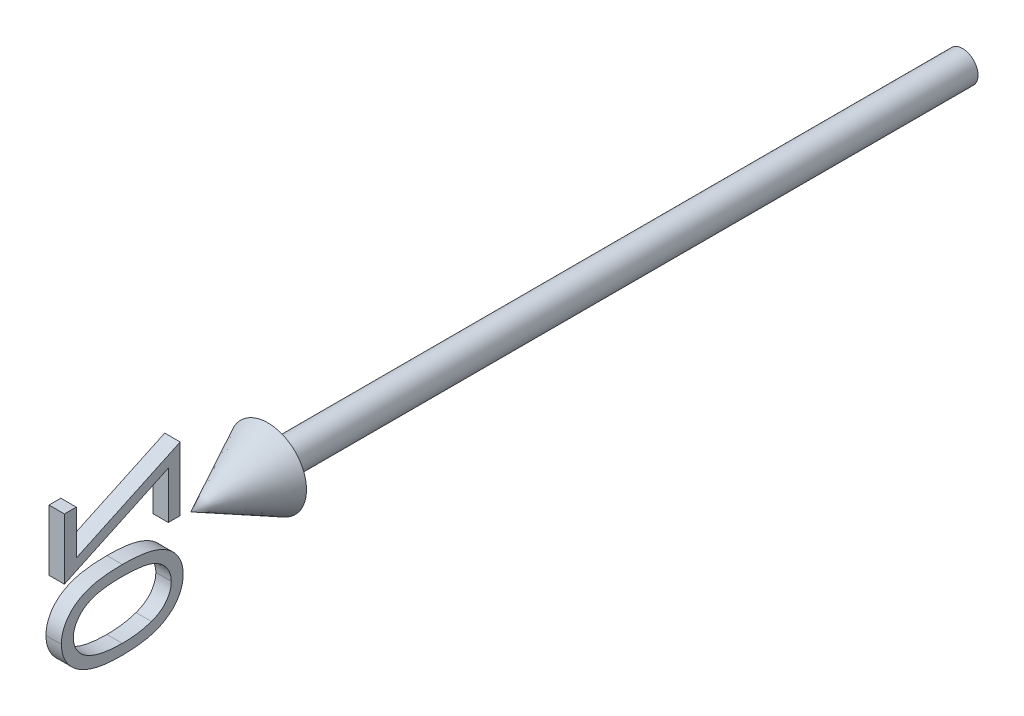
from build123d import *

# Parameters (mm, degrees)
BOSS_EXTRUDE1_DEPTH        = 1
BOSS_EXTRUDE1_DEPTH_BACK   = 1
BOSS_EXTRUDE1_2_DEPTH      = 1
BOSS_EXTRUDE1_2_DEPTH_BACK = 1


with BuildPart() as part:
    # Sketch2 → Revolve1 (revolve)
    with BuildSketch(Plane(origin=(0, 0, 0), x_dir=(1, 0, 0), z_dir=(0, 1, 0))):
        Polygon((0, -100), (5, -90), (2, -90), (2, 0), (0, 0), align=None)
    revolve(axis=Axis((0, 0, -41.949952025), (0, 0, 1)))


with BuildPart() as body_2:
    # Sketch3 → Boss-Extrude1 (new, two sides: drawn at the far end of the back side and taken through both)
    with BuildSketch(Plane(origin=(0, 0, 0), x_dir=(0, -1, 0), z_dir=(1, 0, 0)).offset(-BOSS_EXTRUDE1_DEPTH_BACK)):
        Polygon((-8.958586521, -115.829050545), (-8.958586521, -117.367512083), (-1.073971137, -117.367512083), (-7.366038444, -103.905973622), (-1.266278829, -103.905973622), (-1.266278829, -102.367512083), (-9.535509598, -102.367512083), (-3.243442291, -115.829050545), align=None)
    extrude(amount=BOSS_EXTRUDE1_DEPTH + BOSS_EXTRUDE1_DEPTH_BACK)


with BuildPart() as body_3:
    # Sketch3 → Boss-Extrude1 2 (new, two sides: drawn at the far end of the back side and taken through both)
    with BuildSketch(Plane(origin=(0, 0, 0), x_dir=(0, -1, 0), z_dir=(1, 0, 0)).offset(-BOSS_EXTRUDE1_2_DEPTH_BACK)):
        with BuildLine():
            add(Edge.make_bspline(
                [(0.464490402, -109.861502468), (0.465896194, -110.101919844), (0.468626965, -110.568934062), (0.499005913, -111.24943967), (0.549471662, -111.887840912), (0.618631845, -112.484168325), (0.702794571, -113.038575931), (0.815146812, -113.549581885), (0.942915443, -114.019552124), (1.090999113, -114.450016379), (1.258083581, -114.846783703), (1.439966057, -115.217157182), (1.643739441, -115.560694379), (1.858196956, -115.882456895), (2.090844214, -116.179206612), (2.340872181, -116.449609881), (2.606078592, -116.697857002), (2.88771833, -116.919865871), (3.183107018, -117.113316985), (3.483506669, -117.288676045), (3.7974853, -117.427389898), (4.117298457, -117.54600622), (4.445522801, -117.639966378), (4.782301317, -117.705323043), (5.127936212, -117.746211561), (5.361209824, -117.75013679), (5.47951444, -117.752127468)],
                knots=[0, 0, 0, 0, 1.64625301, 3.197870201, 4.6634513, 6.030635694, 7.308242971, 8.501545196, 9.611429483, 10.641742253, 11.616230371, 12.55791849, 13.464870342, 14.34944951, 15.20427819, 16.044004467, 16.869007726, 17.689551165, 18.496129964, 19.285613293, 20.0683943, 20.843080271, 21.620342827, 22.403213977, 23.190190624, 24, 24, 24, 24], degree=3))
            add(Edge.make_bspline(
                [(5.47951444, -117.752127468), (5.598867202, -117.750472111), (5.836337191, -117.747178534), (6.186159255, -117.700819453), (6.529888015, -117.640982447), (6.862308428, -117.545013741), (7.189705924, -117.430174739), (7.503938784, -117.278646501), (7.81610109, -117.113847775), (8.112011727, -116.912807191), (8.400511963, -116.690624262), (8.670950813, -116.438389837), (8.930241416, -116.16308453), (9.168590469, -115.858568228), (9.396213279, -115.529510069), (9.604469055, -115.173151597), (9.797689138, -114.790282552), (9.979505552, -114.38267786), (10.138499204, -113.939449766), (10.279857271, -113.463362801), (10.395724126, -112.950105768), (10.491543977, -112.402537834), (10.565918422, -111.817946355), (10.620046885, -111.197515781), (10.648649073, -110.540857962), (10.654034477, -110.091895611), (10.656798094, -109.861502468)],
                knots=[0, 0, 0, 0, 0.810910589, 1.61342667, 2.396193133, 3.181089899, 3.963115317, 4.752255436, 5.550715454, 6.36105385, 7.181178335, 8.024612154, 8.872680183, 9.750181803, 10.651284446, 11.591556747, 12.554036451, 13.566402641, 14.62422919, 15.753422176, 16.94128843, 18.199818041, 19.531985927, 20.947085226, 22.433341622, 24, 24, 24, 24], degree=3))
            add(Edge.make_bspline(
                [(10.656798094, -109.861502468), (10.653970235, -109.632117153), (10.648447932, -109.184168749), (10.620697831, -108.530422948), (10.564467416, -107.913377908), (10.495932708, -107.332139642), (10.397119068, -106.787467926), (10.287109959, -106.276437669), (10.146787166, -105.803850614), (9.991564806, -105.364421768), (9.812278245, -104.958543726), (9.620513341, -104.57725504), (9.409148778, -104.222918982), (9.185893633, -103.891775084), (8.943032158, -103.58987039), (8.687250529, -103.311485461), (8.414188003, -103.05881281), (8.124202643, -102.8340065), (7.825495117, -102.631451496), (7.513271955, -102.460776547), (7.19484201, -102.311982821), (6.866893202, -102.192370066), (6.531516762, -102.097815713), (6.187504946, -102.033448325), (5.836290408, -101.988077422), (5.598851553, -101.984629586), (5.47951444, -101.982896699)],
                knots=[0, 0, 0, 0, 1.561431216, 3.049195289, 4.452146966, 5.778046447, 7.031138842, 8.218704273, 9.334037798, 10.384210803, 11.388620812, 12.352076869, 13.287433199, 14.19507451, 15.06813243, 15.922055533, 16.766344942, 17.596869952, 18.417486629, 19.220035357, 20.016159057, 20.807716045, 21.59340902, 22.384936649, 23.188266813, 24, 24, 24, 24], degree=3))
            add(Edge.make_bspline(
                [(5.47951444, -101.982896699), (5.361213947, -101.984905019), (5.127948465, -101.988865035), (4.782254012, -102.029498724), (4.44596381, -102.095758583), (4.118405567, -102.18573913), (3.79890901, -102.300099116), (3.490603617, -102.445560608), (3.189418903, -102.614273953), (2.896724751, -102.806214516), (2.618116601, -103.026182731), (2.351933625, -103.269425772), (2.105142979, -103.542212281), (1.874100145, -103.84018837), (1.657863216, -104.162760869), (1.454952755, -104.508928029), (1.273624174, -104.88290958), (1.102751263, -105.281830782), (0.952125487, -105.715457976), (0.82060184, -106.187038734), (0.709715439, -106.699789674), (0.621392873, -107.253735339), (0.549036995, -107.848018185), (0.499055664, -108.483585234), (0.468642154, -109.159075157), (0.465899573, -109.623087332), (0.464490402, -109.861502468)],
                knots=[0, 0, 0, 0, 0.810976328, 1.599087026, 2.383086309, 3.159618043, 3.926613167, 4.707144544, 5.494386734, 6.292609454, 7.104690378, 7.92621526, 8.762510248, 9.62398222, 10.509836085, 11.424023232, 12.373226806, 13.358118208, 14.398657954, 15.5185989, 16.713620699, 17.994156382, 19.364120462, 20.818119981, 22.365111093, 24, 24, 24, 24], degree=3))
        make_face()
        with BuildLine():
            add(Edge.make_bspline(
                [(1.810644248, -109.867512083), (1.811167389, -109.667161318), (1.812182703, -109.278319823), (1.83793945, -108.714264865), (1.873790211, -108.187286863), (1.918892548, -107.697591511), (1.986439653, -107.246890218), (2.063076152, -106.833309457), (2.154996357, -106.457614093), (2.264292702, -106.116523199), (2.388785301, -105.805199362), (2.524493273, -105.515370407), (2.671494339, -105.243510994), (2.833161137, -104.990601992), (3.011809892, -104.758055959), (3.203453101, -104.544768457), (3.40920511, -104.351607934), (3.69396548, -104.122365531), (4.068073456, -103.882684347), (4.541843799, -103.67653575), (5.028878765, -103.546147131), (5.35954219, -103.529611622), (5.524586556, -103.521358237)],
                knots=[0, 0, 0, 0, 1.459193451, 2.832007961, 4.111736495, 5.306635028, 6.412683014, 7.430020708, 8.369596877, 9.227877302, 10.036669781, 10.810175692, 11.557788084, 12.286326232, 12.994037279, 13.69140682, 14.37267704, 15.047194847, 16.352618509, 17.594157723, 18.799169539, 20, 20, 20, 20], degree=3))
            add(Edge.make_bspline(
                [(5.524586556, -103.521358237), (5.690578634, -103.528595325), (6.021973981, -103.54304383), (6.508677441, -103.669144688), (6.977262383, -103.874144638), (7.347064651, -104.108352222), (7.627622934, -104.332823763), (7.828712483, -104.523986677), (8.013259468, -104.738095126), (8.188298224, -104.969088809), (8.34883676, -105.221400374), (8.494821738, -105.49381115), (8.628036056, -105.787079127), (8.703931971, -105.991806571), (8.742735594, -106.096478429)],
                knots=[0, 0, 0, 0, 1.353621445, 2.702441307, 4.075953605, 5.516772412, 6.261413105, 7.007624062, 7.778524365, 8.566925914, 9.372323995, 10.217594641, 11.088702136, 12, 12, 12, 12], degree=3))
            add(Edge.make_bspline(
                [(8.742735594, -106.096478429), (8.787957456, -106.23032017), (8.87977723, -106.502076302), (8.998113405, -106.923634811), (9.091307973, -107.365932371), (9.175150969, -107.826325728), (9.232378352, -108.308210161), (9.278440408, -108.810094664), (9.305571924, -109.332357645), (9.308935143, -109.687193321), (9.310644248, -109.867512083)],
                knots=[0, 0, 0, 0, 0.884706709, 1.796334032, 2.740027952, 3.714592787, 4.726048262, 5.777819803, 6.87074269, 8, 8, 8, 8], degree=3))
            add(Edge.make_bspline(
                [(9.310644248, -109.867512083), (9.308759288, -110.047826969), (9.305071447, -110.400605066), (9.280841997, -110.916719741), (9.241907287, -111.407774064), (9.189210007, -111.874213501), (9.116867799, -112.315207859), (9.029991961, -112.731388135), (8.928140168, -113.122642335), (8.81131258, -113.489978769), (8.679651387, -113.832079558), (8.534198771, -114.149681124), (8.379003517, -114.444496447), (8.210328001, -114.71557727), (8.030558699, -114.964505362), (7.833240727, -115.185550558), (7.630907566, -115.389466089), (7.343146993, -115.618070421), (6.969481185, -115.85299912), (6.501307362, -116.063313642), (6.016767644, -116.187783452), (5.688528625, -116.205044658), (5.524586556, -116.213665929)],
                knots=[0, 0, 0, 0, 1.313528337, 2.569860077, 3.762944266, 4.901481389, 5.988248151, 7.017139294, 7.997571128, 8.932104357, 9.823695246, 10.66607014, 11.475539426, 12.248954257, 12.990316782, 13.708962568, 14.405488541, 15.08007697, 16.381737273, 17.610043218, 18.806313575, 20, 20, 20, 20], degree=3))
            add(Edge.make_bspline(
                [(5.524586556, -116.213665929), (5.35865184, -116.205034456), (5.026480116, -116.187755786), (4.536871559, -116.063752792), (4.065895038, -115.854494944), (3.693016666, -115.617779915), (3.409307178, -115.390353889), (3.207414438, -115.196250588), (3.016880382, -114.98495777), (2.839087451, -114.753466107), (2.678407031, -114.501039358), (2.529619301, -114.231150766), (2.394994046, -113.941752343), (2.270031538, -113.630600572), (2.161894888, -113.288949202), (2.064667433, -112.913328763), (1.989622468, -112.497058307), (1.922989134, -112.044240523), (1.872621908, -111.553962956), (1.83818931, -111.025737472), (1.812104472, -110.459716256), (1.811140738, -110.068867155), (1.810644248, -109.867512083)],
                knots=[0, 0, 0, 0, 1.207779899, 2.417760083, 3.652287919, 4.947299644, 5.621638849, 6.297435916, 6.984320042, 7.691843698, 8.42018894, 9.161205785, 9.934506883, 10.743085206, 11.601138371, 12.542248028, 13.566483018, 14.679455109, 15.87477181, 17.154161492, 18.533899613, 20, 20, 20, 20], degree=3))
        make_face(mode=Mode.SUBTRACT)
    extrude(amount=BOSS_EXTRUDE1_2_DEPTH + BOSS_EXTRUDE1_2_DEPTH_BACK)


solid = Compound([part.part, body_2.part, body_3.part])
